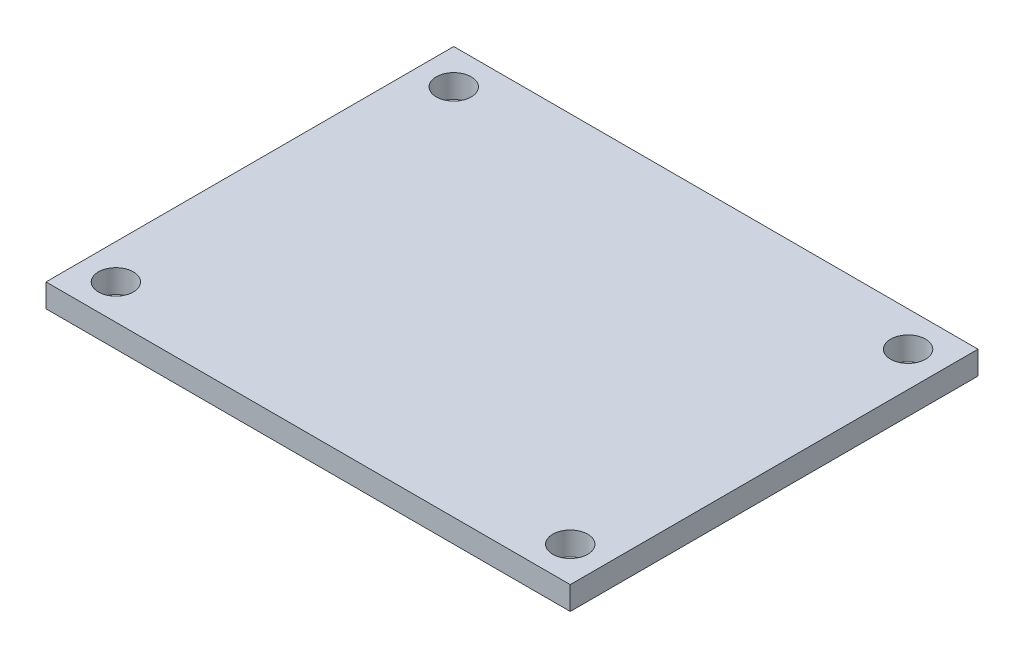
from build123d import *

# Parameters (mm, degrees)
SKETCH1_W           = 45
SKETCH1_H           = 35
SKETCH1_R           = 1.5
BOSS_EXTRUDE1_DEPTH = 2


with BuildPart() as part:
    # Sketch1 → Boss-Extrude1 (new body)
    with BuildSketch(Plane(origin=(0, 0, 0), x_dir=(1, 0, 0), z_dir=(0, 1, 0))):
        Rectangle(SKETCH1_W, SKETCH1_H)
        with Locations((-19.5, 14.5)):
            Circle(SKETCH1_R, mode=Mode.SUBTRACT)
        with Locations((19.5, 14.5)):
            Circle(SKETCH1_R, mode=Mode.SUBTRACT)
        with Locations((-19.5, -14.5)):
            Circle(SKETCH1_R, mode=Mode.SUBTRACT)
        with Locations((19.5, -14.5)):
            Circle(SKETCH1_R, mode=Mode.SUBTRACT)
    extrude(amount=BOSS_EXTRUDE1_DEPTH)


solid = part.part
